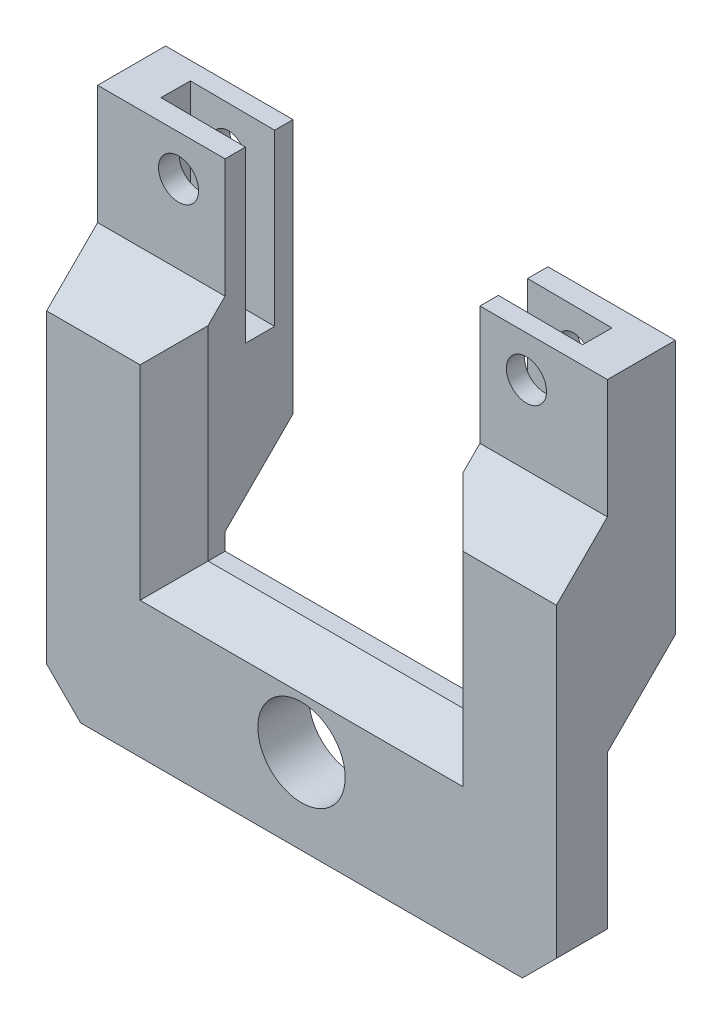
from build123d import *

# Parameters (mm, degrees)
SKETCH1_W           = 38.1
SKETCH1_H           = 38.1
BOSS_EXTRUDE1_DEPTH = 8.89
SKETCH3_W           = 38.1
SKETCH3_H           = 12.7
CUT_EXTRUDE1_DEPTH  = 3.81
SKETCH4_R           = 1.27
CUT_EXTRUDE2_DEPTH  = 28.415532094
SKETCH6_W           = 19.05
SKETCH6_H           = 31.75
CUT_EXTRUDE5_DEPTH  = 29.369651038
CUT_EXTRUDE6_DEPTH  = 12.7
SKETCH8_W           = 38.1
SKETCH8_H           = 19.05
CUT_EXTRUDE7_DEPTH  = 5.08
SKETCH9_R           = 3.2639
CUT_EXTRUDE8_DEPTH  = 29.369651038
CUT_EXTRUDE9_REACH  = 29.416
SKETCH10_R          = 1.5
CHAMFER6_SIZE       = 5.08
CHAMFER7_SIZE       = 3.81
CHAMFER8_SIZE       = 2.54
CHAMFER9_SIZE       = 2.54


with BuildPart() as part:
    # Sketch1 → Boss-Extrude1 (new body)
    with BuildSketch(Plane.XY):
        Rectangle(SKETCH1_W, SKETCH1_H)
    extrude(amount=-BOSS_EXTRUDE1_DEPTH)

    # Sketch3 → Cut-Extrude1 (cut)
    with BuildSketch(Plane.XY):
        with Locations((0, 12.7)):
            Rectangle(SKETCH3_W, SKETCH3_H)
    extrude(amount=-CUT_EXTRUDE1_DEPTH, mode=Mode.SUBTRACT)

    # Sketch4 → Cut-Extrude2 (cut, through all)
    with BuildSketch(Plane.XY.offset(-3.81)):
        with Locations((-13, 16.002)):
            Circle(SKETCH4_R)
        with Locations(Location((13, 16.002, 0), (0, 0, 180))):
            Circle(SKETCH4_R)
    extrude(amount=-CUT_EXTRUDE2_DEPTH, mode=Mode.SUBTRACT)

    # Sketch6 → Cut-Extrude5 (cut, through all)
    with BuildSketch(Plane.XY):
        with Locations((0, 9.525)):
            Rectangle(SKETCH6_W, SKETCH6_H)
    extrude(amount=-CUT_EXTRUDE5_DEPTH, mode=Mode.SUBTRACT)

    # Sketch7 → Cut-Extrude6 (cut)
    with BuildSketch(Plane(origin=(0, 19.05, 0), x_dir=(1, 0, 0), z_dir=(0, 1, 0))):
        Polygon((15.882742773, 7.323143279), (-15.866364793, 7.561195322), (-15.882742773, 5.376856721), (15.866364793, 5.138804678), align=None)
    extrude(amount=-CUT_EXTRUDE6_DEPTH, mode=Mode.SUBTRACT)

    # Sketch8 → Cut-Extrude7 (cut)
    with BuildSketch(Plane(origin=(0, 0, -8.89), x_dir=(-1, 0, 0), z_dir=(0, 0, -1))):
        with Locations((0, -9.525)):
            Rectangle(SKETCH8_W, SKETCH8_H)
    extrude(amount=-CUT_EXTRUDE7_DEPTH, mode=Mode.SUBTRACT)

    # Sketch9 → Cut-Extrude8 (cut, through all)
    with BuildSketch(Plane.XY):
        with Locations((0, -12.7)):
            Circle(SKETCH9_R)
    extrude(amount=-CUT_EXTRUDE8_DEPTH, mode=Mode.SUBTRACT)

    # Cut-Extrude9: up to this plane
    cut_extrude9_end = Plane(origin=(15.866364793, 6.35, -5.138804678), z_dir=(-0.007497702129822743, 0, 0.9999718918363518))
    # Sketch10 → Cut-Extrude9 (cut, up to the surface)
    with BuildSketch(Plane.XY.offset(-3.81), mode=Mode.PRIVATE) as cut_extrude9_sk1:
        with Locations((-13, 16.002)):
            Circle(SKETCH10_R)
    cut_extrude9_tool1 = split(extrude(cut_extrude9_sk1.sketch, amount=-CUT_EXTRUDE9_REACH, mode=Mode.PRIVATE), bisect_by=cut_extrude9_end, keep=Keep.BOTH, mode=Mode.PRIVATE)
    add(cut_extrude9_tool1.solids().sort_by_distance((-13, 16.002, -3.81))[0], mode=Mode.SUBTRACT)
    # Sketch10 → Cut-Extrude9 (cut, up to the surface)
    with BuildSketch(Plane.XY.offset(-3.81), mode=Mode.PRIVATE) as cut_extrude9_sk2:
        with Locations((13, 16.002)):
            Circle(SKETCH10_R)
    cut_extrude9_tool2 = split(extrude(cut_extrude9_sk2.sketch, amount=-CUT_EXTRUDE9_REACH, mode=Mode.PRIVATE), bisect_by=cut_extrude9_end, keep=Keep.BOTH, mode=Mode.PRIVATE)
    add(cut_extrude9_tool2.solids().sort_by_distance((13, 16.002, -3.81))[0], mode=Mode.SUBTRACT)

    # Chamfer6
    chamfer6_edges = [part.edges().sort_by_distance(p)[0] for p in [
        (-14.2875, 0, -3.81),
        (14.2875, 0, -3.81),
    ]]
    chamfer(chamfer6_edges, length=CHAMFER6_SIZE - 0.0001)  # a hair under: the kernel refuses the full size

    # Chamfer7
    chamfer7_edges = [part.edges().sort_by_distance(p)[0] for p in [
        (-14.2875, 6.35, -3.81),
        (14.2875, 6.35, -3.81),
    ]]
    chamfer(chamfer7_edges, length=CHAMFER7_SIZE - 0.0001)  # a hair under: the kernel refuses the full size

    # Chamfer8
    chamfer8_edges = [part.edges().sort_by_distance(p)[0] for p in [
        (-9.525, 0, 0),
        (0, -6.35, 0),
        (9.525, 0, 0),
    ]]
    chamfer(chamfer8_edges, length=CHAMFER8_SIZE)

    # Chamfer9
    chamfer9_edges = [part.edges().sort_by_distance(p)[0] for p in [
        (-19.05, -19.05, -1.905),
        (19.05, -19.05, -1.905),
        (0, -19.05, -3.81),
    ]]
    chamfer(chamfer9_edges, length=CHAMFER9_SIZE)


solid = part.part
